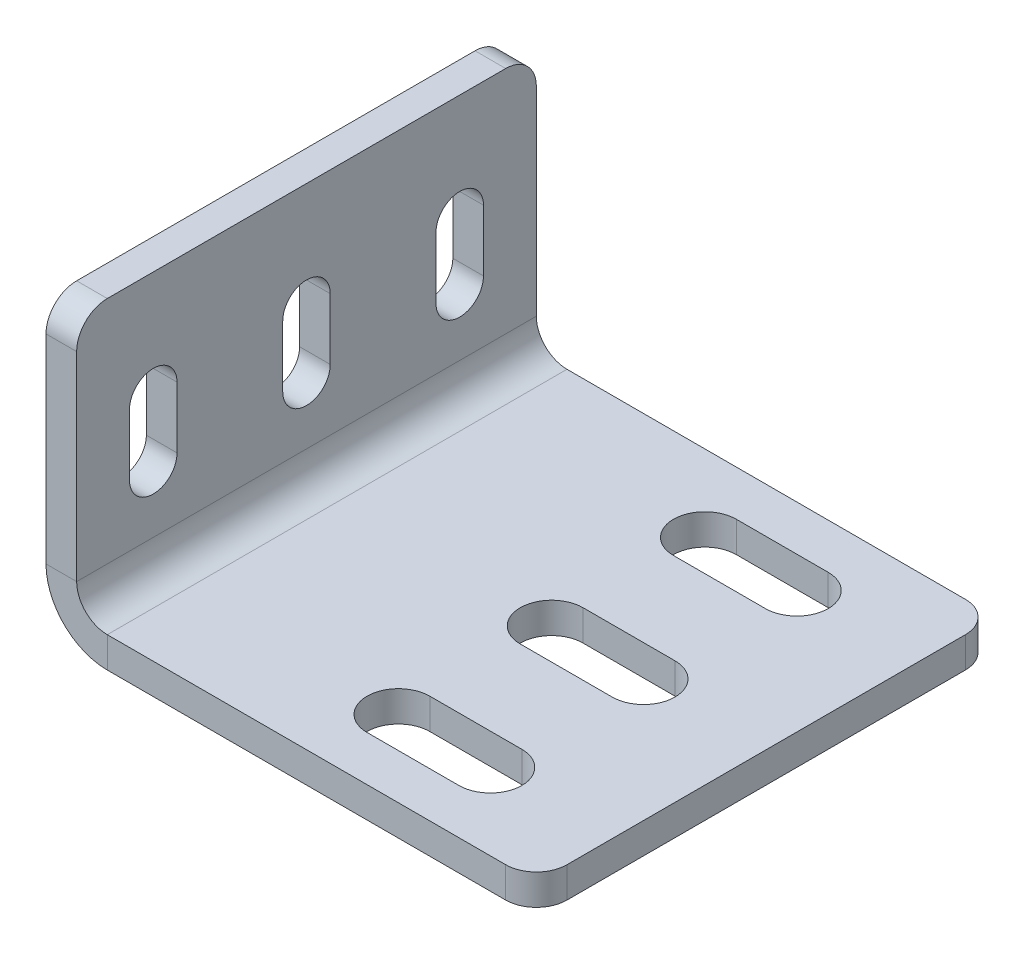
from build123d import *

# Parameters (mm, degrees)
SM_BASE_FLANGE_1_DEPTH = 30
CUT_EXTRUDE_1_DEPTH    = 10
CUT_EXTRUDE_2_DEPTH    = 10
FILLET_1_R             = 2


# Sheet-metal steps are written as plain solids
with BuildPart() as part:
    # Sketch 1 → 基体-法兰1 (new body)
    with BuildSketch(Plane.XY):
        with BuildLine():
            Line((0, 19), (0, 4))
            ThreePointArc((0, 4), (1.171572875, 1.171572875), (4, 0))
            Line((4, 0), (32, 0))
            Line((32, 0), (32, 2))
            Line((32, 2), (4, 2))
            ThreePointArc((4, 2), (2.585786438, 2.585786438), (2, 4))
            Line((2, 4), (2, 19))
            Line((2, 19), (0, 19))
        make_face()
    extrude(amount=SM_BASE_FLANGE_1_DEPTH)

    # 草图6 → 切除-拉伸1 (cut)
    with BuildSketch(Plane.ZY):
        with BuildLine():
            Line((23.45, 8), (23.45, 12))
            ThreePointArc((23.45, 12), (25, 13.55), (26.55, 12))
            Line((26.55, 12), (26.55, 8))
            ThreePointArc((26.55, 8), (25, 6.45), (23.45, 8))
        make_face()
        with BuildLine():
            Line((13.45, 8), (13.45, 12))
            ThreePointArc((13.45, 12), (15, 13.55), (16.55, 12))
            Line((16.55, 12), (16.55, 8))
            ThreePointArc((16.55, 8), (15, 6.45), (13.45, 8))
        make_face()
        with BuildLine():
            Line((3.45, 8), (3.45, 12))
            ThreePointArc((3.45, 12), (5, 13.55), (6.55, 12))
            Line((6.55, 12), (6.55, 8))
            ThreePointArc((6.55, 8), (5, 6.45), (3.45, 8))
        make_face()
    extrude(amount=-CUT_EXTRUDE_1_DEPTH, mode=Mode.SUBTRACT)

    # 草图10 → 切除-拉伸2 (cut)
    with BuildSketch(Plane(origin=(0, 2, 0), x_dir=(1, 0, 0), z_dir=(0, 1, 0))):
        with BuildLine():
            Line((24, -27.05), (18, -27.05))
            ThreePointArc((18, -27.05), (15.95, -25), (18, -22.95))
            Line((18, -22.95), (24, -22.95))
            ThreePointArc((24, -22.95), (26.05, -25), (24, -27.05))
        make_face()
        with BuildLine():
            Line((24, -17.05), (18, -17.05))
            ThreePointArc((18, -17.05), (15.95, -15), (18, -12.95))
            Line((18, -12.95), (24, -12.95))
            ThreePointArc((24, -12.95), (26.05, -15), (24, -17.05))
        make_face()
        with BuildLine():
            Line((24, -7.05), (18, -7.05))
            ThreePointArc((18, -7.05), (15.95, -5), (18, -2.95))
            Line((18, -2.95), (24, -2.95))
            ThreePointArc((24, -2.95), (26.05, -5), (24, -7.05))
        make_face()
    extrude(amount=-CUT_EXTRUDE_2_DEPTH, mode=Mode.SUBTRACT)

    # 圆角1
    fillet_1_edges = [part.edges().sort_by_distance(p)[0] for p in [
        (1, 19, 30),
        (1, 19, 0),
        (32, 1, 30),
        (32, 1, 0),
    ]]
    fillet(fillet_1_edges, radius=FILLET_1_R)


solid = part.part
